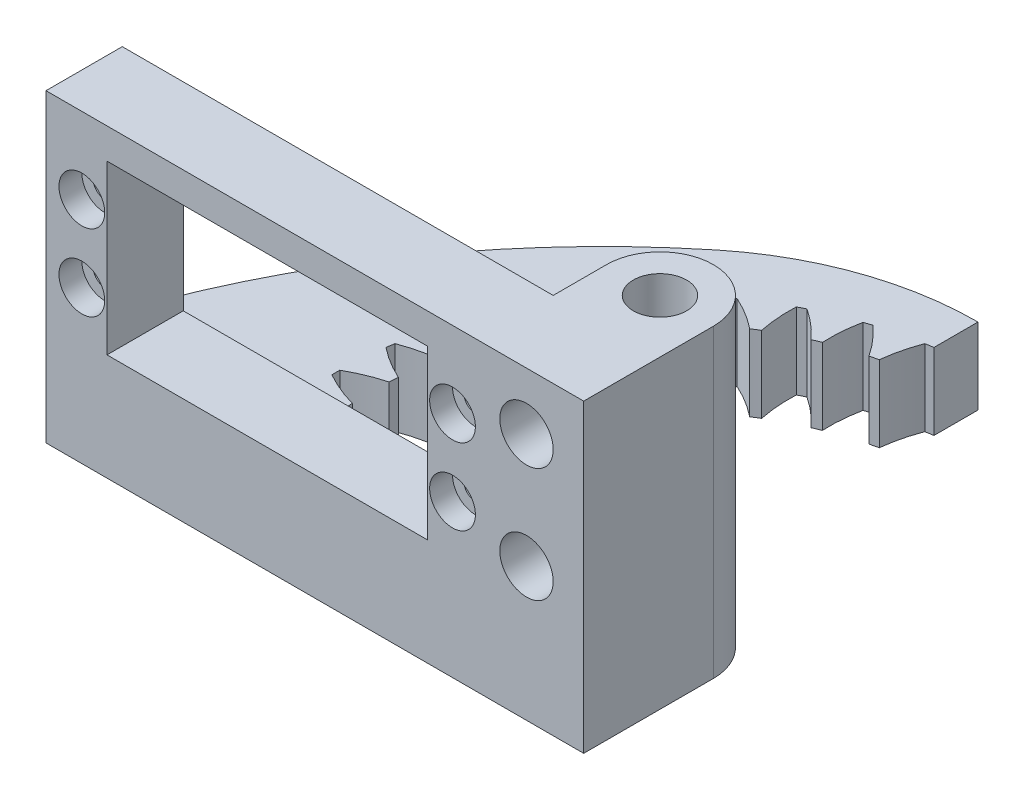
from build123d import *

# Parameters (mm, degrees)
SKETCH1_R                = 3.5
SKETCH1_R_2              = 1.5
SKETCH1_W                = 42
SKETCH1_H                = 22
BOSS_EXTRUDE1_DEPTH      = 10
CUT_EXTRUDE1_START       = 7
SKETCH2_R                = 3
CUT_EXTRUDE1_DEPTH       = 3
BOSS_EXTRUDE2_START      = -15
SKETCH4_R                = 5
BOSS_EXTRUDE2_DEPTH      = 10
BOSS_EXTRUDE3_DEPTH      = 15
BOSS_EXTRUDE3_DEPTH_BACK = 25
SKETCH4_3_R              = 5
SKETCH1_3_R              = 3.5
BOSS_EXTRUDE4_DEPTH      = 4
BOSS_EXTRUDE5_START      = -15
BOSS_EXTRUDE5_DEPTH      = 10
BOSS_EXTRUDE6_DEPTH      = 15
BOSS_EXTRUDE6_DEPTH_BACK = 25
SKETCH6_R                = 5
SKETCH6_R_2              = 3.5
BOSS_EXTRUDE7_START      = -19
SKETCH6_2_R              = 3.5
BOSS_EXTRUDE7_DEPTH      = 28


with BuildPart() as part:
    # Sketch1 → Boss-Extrude1 (new body)
    with BuildSketch(Plane.XY):
        Polygon((34, -15), (-29, -15), (-29, 15), (34, 15), (41.5, 15), (41.5, 7.5), (41.5, -7.5), (41.5, -15), align=None)
        with Locations((34, -7.5)):
            Circle(SKETCH1_R, mode=Mode.SUBTRACT)
        with Locations((34, 7.5)):
            Circle(SKETCH1_R, mode=Mode.SUBTRACT)
        with Locations((24.3, 5)):
            Circle(SKETCH1_R_2, mode=Mode.SUBTRACT)
        with Locations((24.3, -5)):
            Circle(SKETCH1_R_2, mode=Mode.SUBTRACT)
        with Locations(Location((-24.3, -5, 0), (0, 0, 180))):
            Circle(SKETCH1_R_2, mode=Mode.SUBTRACT)
        with Locations(Location((-24.3, 5, 0), (0, 0, 180))):
            Circle(SKETCH1_R_2, mode=Mode.SUBTRACT)
        Rectangle(SKETCH1_W, SKETCH1_H, mode=Mode.SUBTRACT)
    extrude(amount=BOSS_EXTRUDE1_DEPTH)

    # Sketch2 → Cut-Extrude1 (cut)
    with BuildSketch(Plane.XY.offset(CUT_EXTRUDE1_START)):
        with Locations((-24.3, 5)):
            Circle(SKETCH2_R)
        with Locations((-24.3, -5)):
            Circle(SKETCH2_R)
        with Locations((24.3, 5)):
            Circle(SKETCH2_R)
        with Locations((24.3, -5)):
            Circle(SKETCH2_R)
    extrude(amount=CUT_EXTRUDE1_DEPTH, mode=Mode.SUBTRACT)

    # Sketch4 → Boss-Extrude2 (add)
    # profile 1 of 3: a face of its own
    with BuildSketch(Plane(origin=(0, 0, 0), x_dir=(1, 0, 0), z_dir=(0, 1, 0)).offset(BOSS_EXTRUDE2_START)):
        with BuildLine():
            Line((41.5, 0), (41.5, 7))
            ThreePointArc((41.5, 7), (34.5, 14), (27.5, 7))
            Line((27.5, 7), (27.5, 0))
            Line((27.5, 0), (41.5, 0))
        make_face()
        with Locations((34.5, 7)):
            Circle(SKETCH4_R, mode=Mode.SUBTRACT)
    # profile 2 of 3: a face of its own
    with BuildSketch(Plane(origin=(0, 0, 0), x_dir=(1, 0, 0), z_dir=(0, 1, 0)).offset(BOSS_EXTRUDE2_START)):
        Polygon((-29, -10), (-29, 0), (27.5, 0), (41.5, 0), (41.5, -10), align=None)
    # profile 3 of 3: a face of its own
    with BuildSketch(Plane(origin=(0, 0, 0), x_dir=(1, 0, 0), z_dir=(0, 1, 0)).offset(BOSS_EXTRUDE2_START)):
        with BuildLine():
            Line((-29, 0), (-9.952221542, 0))
            ThreePointArc((-9.952221542, 0), (-7.49675311, 23.163932944), (6.211711403, 41.99675311))
            Line((6.211711403, 41.99675311), (3.068568225, 45.885281233))
            ThreePointArc((3.068568225, 45.885281233), (-16.210887038, 25.210644422), (-29, 0))
        make_face()
    extrude(amount=-BOSS_EXTRUDE2_DEPTH)

    # Sketch4<3> → Boss-Extrude3 (add, two sides: drawn at the far end of the back side and taken through both)
    with BuildSketch(Plane(origin=(0, 0, 0), x_dir=(1, 0, 0), z_dir=(0, 1, 0)).offset(-BOSS_EXTRUDE3_DEPTH_BACK)):
        with BuildLine():
            Line((41.5, 0), (41.5, 7))
            ThreePointArc((41.5, 7), (34.5, 14), (27.5, 7))
            Line((27.5, 7), (27.5, 0))
            Line((27.5, 0), (41.5, 0))
        make_face()
        with Locations((34.5, 7)):
            Circle(SKETCH4_3_R, mode=Mode.SUBTRACT)
    extrude(amount=BOSS_EXTRUDE3_DEPTH + BOSS_EXTRUDE3_DEPTH_BACK)

    # Sketch1<3> → Boss-Extrude4 (add)
    with BuildSketch(Plane.XY):
        with Locations((34, 7.5)):
            Circle(SKETCH1_3_R)
        with Locations((34, -7.5)):
            Circle(SKETCH1_3_R)
    extrude(amount=BOSS_EXTRUDE4_DEPTH)

    # Sketch5 → Boss-Extrude5 (add)
    with BuildSketch(Plane(origin=(0, 0, 0), x_dir=(1, 0, 0), z_dir=(0, 1, 0)).offset(BOSS_EXTRUDE5_START)):
        with BuildLine():
            Line((-7.556310354, 0), (-29, 0))
            ThreePointArc((-29, 0), (-16.210887038, 25.210644422), (3.068568225, 45.885281233))
            ThreePointArc((3.068568225, 45.885281233), (14.95066501, 52.529162568), (28.36797257, 54.831604973))
            Line((28.36797257, 54.831604973), (28.36797257, 51.580244948))
            Line((28.36797257, 51.580244948), (28.36797257, 49.056310354))
            ThreePointArc((28.36797257, 49.056310354), (27.851378801, 48.977742164), (27.335790025, 48.892828699))
            ThreePointArc((27.335790025, 48.892828699), (26.606861218, 46.521101207), (26.177213589, 44.077368115))
            ThreePointArc((26.177213589, 44.077368115), (25.629076173, 43.950056975), (25.082884112, 43.814642852))
            ThreePointArc((25.082884112, 43.814642852), (23.590633664, 45.796969038), (21.864411592, 47.579266955))
            ThreePointArc((21.864411592, 47.579266955), (21.366468722, 47.420852999), (20.870511092, 47.256329106))
            ThreePointArc((20.870511092, 47.256329106), (20.521576529, 44.799771926), (20.479502655, 42.318913548))
            ThreePointArc((20.479502655, 42.318913548), (19.95802957, 42.107422235), (19.439745475, 41.888232022))
            ThreePointArc((19.439745475, 41.888232022), (17.65576297, 43.612713083), (15.671980735, 45.103027328))
            ThreePointArc((15.671980735, 45.103027328), (15.204949771, 44.868668285), (14.740835409, 44.628585087))
            ThreePointArc((14.740835409, 44.628585087), (14.780487018, 42.147686811), (15.127022896, 39.690790112))
            ThreePointArc((15.127022896, 39.690790112), (14.645054541, 39.400326245), (14.167440286, 39.102757132))
            ThreePointArc((14.167440286, 39.102757132), (12.135653294, 40.526930621), (9.943158199, 41.688564712))
            ThreePointArc((9.943158199, 41.688564712), (9.518538992, 41.384031278), (9.097695935, 41.074300421))
            ThreePointArc((9.097695935, 41.074300421), (9.524957362, 38.630148998), (10.251570129, 36.257710929))
            ThreePointArc((10.251570129, 36.257710929), (9.820974163, 35.895426693), (9.395790198, 35.526805819))
            ThreePointArc((9.395790198, 35.526805819), (7.166228058, 36.615603857), (4.819006607, 37.419954507))
            ThreePointArc((4.819006607, 37.419954507), (4.447254693, 37.052745307), (4.080045493, 36.680993393))
            ThreePointArc((4.080045493, 36.680993393), (4.884396143, 34.333771942), (5.973194181, 32.104209802))
            ThreePointArc((5.973194181, 32.104209802), (5.604573307, 31.679025837), (5.242289071, 31.248429871))
            ThreePointArc((5.242289071, 31.248429871), (2.869851002, 31.975042638), (0.425699579, 32.402304065))
            ThreePointArc((0.425699579, 32.402304065), (0.115968722, 31.981461008), (-0.188564712, 31.556841801))
            ThreePointArc((-0.188564712, 31.556841801), (0.973069379, 29.364346706), (2.397242868, 27.332559714))
            ThreePointArc((2.397242868, 27.332559714), (2.099673755, 26.854945459), (1.809209888, 26.372977104))
            ThreePointArc((1.809209888, 26.372977104), (-0.647686811, 26.719512982), (-3.128585087, 26.759164591))
            ThreePointArc((-3.128585087, 26.759164591), (-3.368668285, 26.295050229), (-3.603027328, 25.828019265))
            ThreePointArc((-3.603027328, 25.828019265), (-2.112713083, 23.84423703), (-0.388232022, 22.060254525))
            ThreePointArc((-0.388232022, 22.060254525), (-0.607422235, 21.54197043), (-0.818913548, 21.020497345))
            ThreePointArc((-0.818913548, 21.020497345), (-3.299771926, 20.978423471), (-5.756329106, 20.629488908))
            ThreePointArc((-5.756329106, 20.629488908), (-5.920852999, 20.133531278), (-6.079266955, 19.635588408))
            ThreePointArc((-6.079266955, 19.635588408), (-4.296969038, 17.909366336), (-2.314642852, 16.417115888))
            ThreePointArc((-2.314642852, 16.417115888), (-2.450056975, 15.870923827), (-2.577368115, 15.322786411))
            ThreePointArc((-2.577368115, 15.322786411), (-5.021101207, 14.893138782), (-7.392828699, 14.164209975))
            ThreePointArc((-7.392828699, 14.164209975), (-7.477742164, 13.648621199), (-7.556310354, 13.13202743))
            ThreePointArc((-7.556310354, 13.13202743), (-5.525914856, 11.705870837), (-3.334554995, 10.542096605))
            ThreePointArc((-3.334554995, 10.542096605), (-3.382858682, 9.981445638), (-3.422854827, 9.420140853))
            ThreePointArc((-3.422854827, 9.420140853), (-5.769289812, 8.613498821), (-7.997787816, 7.522524415))
            ThreePointArc((-7.997787816, 7.522524415), (-8.001, 7), (-7.997787816, 6.477475585))
            ThreePointArc((-7.997787816, 6.477475585), (-5.769289812, 5.386501179), (-3.422854827, 4.579859147))
            ThreePointArc((-3.422854827, 4.579859147), (-3.382858682, 4.018554362), (-3.334554995, 3.457903395))
            ThreePointArc((-3.334554995, 3.457903395), (-5.525914856, 2.294129163), (-7.556310354, 0.86797257))
            Line((-7.556310354, 0.86797257), (-7.556310354, 0))
        make_face()
    extrude(amount=-BOSS_EXTRUDE5_DEPTH)

    # Sketch6 → Boss-Extrude6 (add, two sides: drawn at the far end of the back side and taken through both)
    with BuildSketch(Plane(origin=(0, 0, 0), x_dir=(1, 0, 0), z_dir=(0, 1, 0)).offset(-BOSS_EXTRUDE6_DEPTH_BACK)):
        with Locations((34.5, 7)):
            Circle(SKETCH6_R)
        with Locations(Location((34.5, 7, 0), (0, 0, 90))):
            Circle(SKETCH6_R_2, mode=Mode.SUBTRACT)
    extrude(amount=BOSS_EXTRUDE6_DEPTH + BOSS_EXTRUDE6_DEPTH_BACK)

    # Sketch6<2> → Boss-Extrude7 (add)
    with BuildSketch(Plane(origin=(0, 0, 0), x_dir=(1, 0, 0), z_dir=(0, 1, 0)).offset(BOSS_EXTRUDE7_START)):
        with Locations(Location((34.5, 7, 0), (0, 0, 90))):
            Circle(SKETCH6_2_R)
    extrude(amount=BOSS_EXTRUDE7_DEPTH)


solid = part.part
